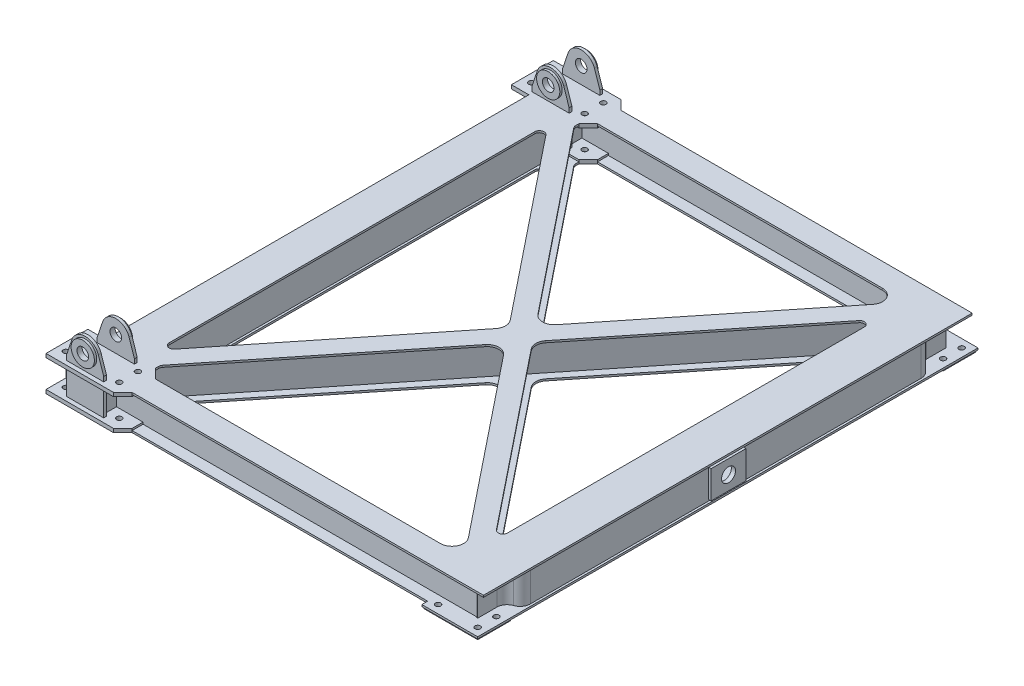
from build123d import *

# Parameters (mm, degrees)
SKETCH_1_W                         = 1765
SKETCH_1_H                         = 2150
EXTRUDE_1_DEPTH                    = 8
SKETCH_2_W                         = 1525
SKETCH_2_H                         = 25
CUT_EXTRUDE_1_DEPTH                = 2782.688156498
SKETCH_4_W                         = 255
SKETCH_4_H                         = 140
CUT_EXTRUDE_2_DEPTH                = 2782.688156498
SKETCH_6_W                         = 6
SKETCH_6_H                         = 1994
SKETCH_6_H_2                       = 2012
EXTRUDE_3_DEPTH                    = 134
SKETCH_7_W                         = 1624
SKETCH_7_H                         = 6
EXTRUDE_5_DEPTH                    = 134
SKETCH_10_W                        = 1765
SKETCH_10_H                        = 2100
EXTRUDE_6_DEPTH                    = 8
CUT_EXTRUDE_3_DEPTH                = 8
FILLET_3_R                         = 50
FILLET_4_R                         = 20
SKETCH_13_R                        = 11.5
EXTRUDE_8_DEPTH                    = 16
EXTRUDE_8_2_DEPTH                  = 16
PATTERN_LINEAR_1_COUNT             = 2
PATTERN_LINEAR_1_PITCH             = 134
SKETCH_14_W                        = 160
SKETCH_14_H                        = 12
EXTRUDE_9_DEPTH                    = 150
SKETCH_15_R                        = 25
CUT_EXTRUDE_4_DEPTH                = 2808.039187471
SKETCH_16_W                        = 160
SKETCH_16_H                        = 12
EXTRUDE_10_DEPTH                   = 134
SKETCH_17_W                        = 6
SKETCH_17_H                        = 118
EXTRUDE_11_DEPTH                   = 84
EXTRUDE_11_2_DEPTH                 = 84
SKETCH_18_W                        = 6
SKETCH_18_H                        = 118
EXTRUDE_12_DEPTH                   = 2132
EXTRUDE_START                      = 10
SKETCH_19_R                        = 50
SKETCH_19_R_2                      = 25
EXTRUDE_13_DEPTH                   = 10
PATTERN_LINEAR_2_COUNT             = 2
PATTERN_LINEAR_2_PITCH             = 154
PATTERN_LINEAR_3_COUNT             = 2
PATTERN_LINEAR_3_PITCH             = 2000
PATTERN_START                      = 10
PATTERN_LINEAR_3_COPY_1_SKETCH_R   = 50
PATTERN_LINEAR_3_COPY_1_SKETCH_R_2 = 25
PATTERN_LINEAR_3_COPY_1_DEPTH      = 10
SKETCH_20_W                        = 230
SKETCH_20_H                        = 140
EXTRUDE_14_DEPTH                   = 8
SKETCH_21_R                        = 11.5
CUT_EXTRUDE_5_DEPTH                = 16
PATTERN_LINEAR_4_COUNT             = 2
PATTERN_LINEAR_4_PITCH             = 170
PATTERN_LINEAR_4_COUNT_DIR2        = 2
PATTERN_LINEAR_4_PITCH_DIR2        = 80
PATTERN_LINEAR_5_COUNT             = 2
PATTERN_LINEAR_5_PITCH             = 2000
PATTERN_LINEAR_5_COPY_1_SKETCH_R   = 11.5
PATTERN_LINEAR_5_COPY_1_DEPTH      = 16
PATTERN_LINEAR_5_COPY_2_SKETCH_R   = 11.5
PATTERN_LINEAR_5_COPY_2_DEPTH      = 16
PATTERN_LINEAR_5_COPY_3_SKETCH_R   = 11.5
PATTERN_LINEAR_5_COPY_3_DEPTH      = 16
SKETCH_23_W                        = 150
SKETCH_23_H                        = 120
EXTRUDE_15_DEPTH                   = 12
SKETCH_24_R                        = 30
CUT_EXTRUDE_6_DEPTH                = 18


with BuildPart() as part:
    # 草图1 → 凸台-拉伸1 (new body)
    with BuildSketch(Plane(origin=(0, 0, 0), x_dir=(1, 0, 0), z_dir=(0, 1, 0))):
        with Locations((882.5, 1075)):
            Rectangle(SKETCH_1_W, SKETCH_1_H)
    extrude(amount=EXTRUDE_1_DEPTH)

    # 草图2 → 切除-拉伸1 (cut, through all)
    with BuildSketch(Plane(origin=(0, 8, 0), x_dir=(1, 0, 0), z_dir=(0, 1, 0))):
        Polygon((215, 2025), (1583.775006101, 2025), (875, 1139.031242374), (215, 1964.031242374), align=None)
        Polygon((1585, 251.531242374), (926.224993899, 1075), (1585, 1898.468757626), align=None)
        Polygon((150, 1917.218757626), (823.775006101, 1075), (150, 232.781242374), align=None)
        Polygon((875, 1010.968757626), (1583.775006101, 125), (215, 125), (215, 185.968757626), align=None)
        with Locations((762.5, 2137.5)):
            Rectangle(SKETCH_2_W, SKETCH_2_H)
        with Locations((762.5, 12.5)):
            Rectangle(SKETCH_2_W, SKETCH_2_H)
    extrude(amount=-CUT_EXTRUDE_1_DEPTH, mode=Mode.SUBTRACT)

    # 草图4 → 切除-拉伸2 (cut, through all)
    with BuildSketch(Plane(origin=(0, 8, 0), x_dir=(1, 0, 0), z_dir=(0, 1, 0))):
        with Locations((127.5, 95)):
            Rectangle(SKETCH_4_W, SKETCH_4_H)
        with Locations((127.5, 2055)):
            Rectangle(SKETCH_4_W, SKETCH_4_H)
    extrude(amount=-CUT_EXTRUDE_2_DEPTH, mode=Mode.SUBTRACT)

    # 草图6 → 凸台-拉伸3 (add)
    with BuildSketch(Plane(origin=(0, 8, 0), x_dir=(1, 0, 0), z_dir=(0, 1, 0))):
        with Locations((138, 1075)):
            Rectangle(SKETCH_6_W, SKETCH_6_H)
        with Locations((12, 1075)):
            Rectangle(SKETCH_6_W, SKETCH_6_H_2)
        with BuildLine():
            Line((1750, 1915), (1750, 235))
            ThreePointArc((1750, 235), (1741.721142199, 209.309534843), (1720, 193.286692771))
            ThreePointArc((1720, 193.286692771), (1698.278857801, 177.263850699), (1690, 151.573385542))
            Line((1690, 151.573385542), (1690, 69))
            Line((1690, 69), (1696, 69))
            Line((1696, 69), (1696, 151.573385542))
            ThreePointArc((1696, 151.573385542), (1704.278857801, 177.263850699), (1726, 193.286692771))
            ThreePointArc((1726, 193.286692771), (1747.721142199, 209.309534843), (1756, 235))
            Line((1756, 235), (1756, 1915))
            ThreePointArc((1756, 1915), (1747.721142199, 1940.690465157), (1726, 1956.713307229))
            ThreePointArc((1726, 1956.713307229), (1704.278857801, 1972.736149301), (1696, 1998.426614458))
            Line((1696, 1998.426614458), (1696, 2081))
            Line((1696, 2081), (1690, 2081))
            Line((1690, 2081), (1690, 1998.426614458))
            ThreePointArc((1690, 1998.426614458), (1698.278857801, 1972.736149301), (1720, 1956.713307229))
            ThreePointArc((1720, 1956.713307229), (1741.721142199, 1940.690465157), (1750, 1915))
        make_face()
        with Locations((1597, 1075)):
            Rectangle(SKETCH_6_W, SKETCH_6_H)
    extrude(amount=EXTRUDE_3_DEPTH)

    # 草图7 → 凸台-拉伸5 (add)
    with BuildSketch(Plane(origin=(0, 8, 0), x_dir=(1, 0, 0), z_dir=(0, 1, 0))):
        with Locations((882.5, 2075)):
            Rectangle(SKETCH_7_W, SKETCH_7_H)
        with Locations((882.5, 75)):
            Rectangle(SKETCH_7_W, SKETCH_7_H)
        Polygon((1594, 1969.177343178), (1594, 1959.572656822), (886.341874542, 1075), (1594, 190.427343178), (1594, 180.822656822), (882.5, 1070.197656822), (141, 143.322656822), (141, 152.927343178), (878.658125458, 1075), (141, 1997.072656822), (141, 2006.677343178), (882.5, 1079.802343178), align=None)
    extrude(amount=EXTRUDE_5_DEPTH)

    # 草图10 → 凸台-拉伸6 (add)
    with BuildSketch(Plane(origin=(0, 142, 0), x_dir=(1, 0, 0), z_dir=(0, 1, 0))):
        with Locations((882.5, 1075)):
            Rectangle(SKETCH_10_W, SKETCH_10_H)
    extrude(amount=EXTRUDE_6_DEPTH)

    # 草图11 → 切除-拉伸3 (cut)
    with BuildSketch(Plane(origin=(0, 150, 0), x_dir=(1, 0, 0), z_dir=(0, 1, 0))):
        Polygon((0, 2125), (255, 2125), (255, 2025), (1583.775006101, 2025), (875, 1139.031242374), (215, 1964.031242374), (215, 1985), (0, 1985), align=None)
        Polygon((823.775006101, 1075), (150, 232.781242374), (150, 1917.218757626), align=None)
        Polygon((1585, 1898.468757626), (926.224993899, 1075), (1585, 251.531242374), align=None)
        Polygon((0, 25), (0, 165), (215, 165), (215, 185.968757626), (875, 1010.968757626), (1583.775006101, 125), (255, 125), (255, 25), align=None)
    extrude(amount=-CUT_EXTRUDE_3_DEPTH, mode=Mode.SUBTRACT)

    # 圆角3
    fillet_3_edges = [part.edges().sort_by_distance(p)[0] for p in [
        (926.224993899, 4, -1075),
        (926.224993899, 146, -1075),
        (875, 4, -1139.031242374),
        (875, 146, -1139.031242374),
        (823.775006101, 4, -1075),
        (823.775006101, 146, -1075),
        (875, 146, -1010.968757626),
        (875, 4, -1010.968757626),
        (1583.775006101, 146, -2025),
        (1583.775006101, 4, -2025),
        (1583.775006101, 146, -125),
        (1583.775006101, 4, -125),
    ]]
    fillet(fillet_3_edges, radius=FILLET_3_R)

    # 圆角4
    fillet_4_edges = [part.edges().sort_by_distance(p)[0] for p in [
        (150, 146, -1917.218757626),
        (150, 4, -1917.218757626),
        (1585, 146, -1898.468757626),
        (1585, 4, -1898.468757626),
        (1585, 146, -251.531242374),
        (1585, 4, -251.531242374),
        (150, 4, -232.781242374),
        (150, 146, -232.781242374),
        (215, 146, -1964.031242374),
        (215, 4, -1964.031242374),
        (215, 4, -185.968757626),
        (215, 146, -185.968757626),
    ]]
    fillet(fillet_4_edges, radius=FILLET_4_R)


with BuildPart() as body_2:
    # 草图13 → 凸台-拉伸8 (new body)
    with BuildSketch(Plane.XZ):
        Polygon((255, -125), (255, -25), (215, 15), (-75, 15), (-75, -165), (215, -165), align=None)
        with Locations((190, -35)):
            Circle(SKETCH_13_R, mode=Mode.SUBTRACT)
        with Locations((190, -115)):
            Circle(SKETCH_13_R, mode=Mode.SUBTRACT)
        with Locations((-40, -35)):
            Circle(SKETCH_13_R, mode=Mode.SUBTRACT)
        with Locations((-40, -115)):
            Circle(SKETCH_13_R, mode=Mode.SUBTRACT)
    extrude_8 = extrude(amount=-EXTRUDE_8_DEPTH)


with BuildPart() as body_3:
    # 草图13 → Extrude 8 2 (new body)
    with BuildSketch(Plane.XZ):
        Polygon((255, -2025), (215, -1985), (-75, -1985), (-75, -2165), (215, -2165), (255, -2125), align=None)
        with Locations((-40, -2035)):
            Circle(SKETCH_13_R, mode=Mode.SUBTRACT)
        with Locations((-40, -2115)):
            Circle(SKETCH_13_R, mode=Mode.SUBTRACT)
        with Locations((190, -2035)):
            Circle(SKETCH_13_R, mode=Mode.SUBTRACT)
        with Locations((190, -2115)):
            Circle(SKETCH_13_R, mode=Mode.SUBTRACT)
    extrude_8_2 = extrude(amount=-EXTRUDE_8_2_DEPTH)


with BuildPart() as part_1:
    add(part.part)

    # 阵列(线性)1: 凸台-拉伸8, Extrude 8 2 ×2
    with Locations(*[(0, i * PATTERN_LINEAR_1_PITCH, 0) for i in range(1, PATTERN_LINEAR_1_COUNT)]):
        add(extrude_8)
        add(extrude_8_2)

    # 草图14 → 凸台-拉伸9 (add)
    with BuildSketch(Plane(origin=(0, 150, 0), x_dir=(1, 0, 0), z_dir=(0, 1, 0))):
        with Locations((75, 2141)):
            Rectangle(SKETCH_14_W, SKETCH_14_H)
        with Locations((75, 2009)):
            Rectangle(SKETCH_14_W, SKETCH_14_H)
        with Locations((75, 141)):
            Rectangle(SKETCH_14_W, SKETCH_14_H)
        with Locations((75, 9)):
            Rectangle(SKETCH_14_W, SKETCH_14_H)
    extrude(amount=EXTRUDE_9_DEPTH)

    # 草图15 → 切除-拉伸4 (cut, through all)
    with BuildSketch(Plane.XY.offset(-3)):
        with Locations((75, 220)):
            Circle(SKETCH_15_R)
        with BuildLine():
            Line((-5, 170), (-5, 300))
            Line((-5, 300), (155, 300))
            Line((155, 300), (155, 170))
            Line((155, 170), (131.899246818, 239.038794908))
            ThreePointArc((131.899246818, 239.038794908), (75, 280), (18.100753182, 239.038794908))
            Line((18.100753182, 239.038794908), (-5, 170))
        make_face()
    extrude(amount=-CUT_EXTRUDE_4_DEPTH, mode=Mode.SUBTRACT)

    add(body_2.part)  # 凸台-拉伸10 merges body 2

    add(body_3.part)  # 凸台-拉伸10 merges body 3
    # 草图16 → 凸台-拉伸10 (add)
    with BuildSketch(Plane(origin=(0, 150, 0), x_dir=(1, 0, 0), z_dir=(0, 1, 0))):
        with Locations((75, 9)):
            Rectangle(SKETCH_16_W, SKETCH_16_H)
        with Locations((75, 141)):
            Rectangle(SKETCH_16_W, SKETCH_16_H)
        with Locations((75, 2009)):
            Rectangle(SKETCH_16_W, SKETCH_16_H)
        with Locations((75, 2141)):
            Rectangle(SKETCH_16_W, SKETCH_16_H)
    extrude(amount=-EXTRUDE_10_DEPTH)



with BuildPart() as body_2_2:
    # 草图17 → 凸台-拉伸11 (new body)
    with BuildSketch(Plane.ZY.offset(75)):
        with Locations((-75, 75)):
            Rectangle(SKETCH_17_W, SKETCH_17_H)
    extrude(amount=-EXTRUDE_11_DEPTH)


with BuildPart() as body_3_2:
    # 草图17 → Extrude 11 2 (new body)
    with BuildSketch(Plane.ZY.offset(75)):
        with Locations((-2075, 75)):
            Rectangle(SKETCH_17_W, SKETCH_17_H)
    extrude(amount=-EXTRUDE_11_2_DEPTH)


with BuildPart() as part_2:
    add(part_1.part)

    add(body_2_2.part)  # 凸台-拉伸12 merges body 2 2

    add(body_3_2.part)  # 凸台-拉伸12 merges body 3 2
    # 草图18 → 凸台-拉伸12 (add)
    with BuildSketch(Plane.XY.offset(-3)):
        with Locations((12, 75)):
            Rectangle(SKETCH_18_W, SKETCH_18_H)
        with Locations((138, 75)):
            Rectangle(SKETCH_18_W, SKETCH_18_H)
    extrude(amount=-EXTRUDE_12_DEPTH)

    # 草图19 → 凸台-拉伸13 (add)
    with BuildSketch(Plane.XY.offset(-3).offset(EXTRUDE_START)):
        with Locations((75, 220)):
            Circle(SKETCH_19_R)
        with Locations((75, 220)):
            Circle(SKETCH_19_R_2, mode=Mode.SUBTRACT)
    extrude_13 = extrude(amount=-EXTRUDE_13_DEPTH)

    # 阵列(线性)2: 凸台-拉伸13 ×2
    with Locations(*[(0, 0, -i * PATTERN_LINEAR_2_PITCH) for i in range(1, PATTERN_LINEAR_2_COUNT)]):
        add(extrude_13)

    # 阵列(线性)3: 凸台-拉伸13 ×2
    with Locations(*[(0, 0, -i * PATTERN_LINEAR_3_PITCH) for i in range(1, PATTERN_LINEAR_3_COUNT)]):
        add(extrude_13)

    # 阵列(线性)3 copy 1 sketch → 阵列(线性)3 copy 1 (add)
    with BuildSketch(Plane.XY.offset(-2157).offset(PATTERN_START)):
        with Locations((75, 220)):
            Circle(PATTERN_LINEAR_3_COPY_1_SKETCH_R)
        with Locations((75, 220)):
            Circle(PATTERN_LINEAR_3_COPY_1_SKETCH_R_2, mode=Mode.SUBTRACT)
    extrude(amount=-PATTERN_LINEAR_3_COPY_1_DEPTH)

    # 草图20 → 凸台-拉伸14 (add)
    with BuildSketch(Plane.XZ):
        with Locations((1645, -75)):
            Rectangle(SKETCH_20_W, SKETCH_20_H)
        with Locations((1645, -2075)):
            Rectangle(SKETCH_20_W, SKETCH_20_H)
    extrude(amount=EXTRUDE_14_DEPTH)

    # 草图21 → 切除-拉伸5 (cut)
    with BuildSketch(Plane.XZ.offset(8)):
        with Locations((1560, -35)):
            Circle(SKETCH_21_R)
    cut_extrude_5 = extrude(amount=-CUT_EXTRUDE_5_DEPTH, mode=Mode.SUBTRACT)

    # 阵列(线性)4: Cut-Extrude 5 2 × 2
    with Locations(*[(i * PATTERN_LINEAR_4_PITCH, 0, -j * PATTERN_LINEAR_4_PITCH_DIR2) for i in range(PATTERN_LINEAR_4_COUNT) for j in range(PATTERN_LINEAR_4_COUNT_DIR2) if (i, j) != (0, 0)]):
        add(cut_extrude_5, mode=Mode.SUBTRACT)

    # 阵列(线性)5: 切除-拉伸5 ×2
    with Locations(*[(0, 0, -i * PATTERN_LINEAR_5_PITCH) for i in range(1, PATTERN_LINEAR_5_COUNT)]):
        add(cut_extrude_5, mode=Mode.SUBTRACT)

    # 阵列(线性)5 copy 1 sketch → 阵列(线性)5 copy 1 (cut)
    with BuildSketch(Plane(origin=(0, -8, -2080), x_dir=(1, 0, 0), z_dir=(0, -1, 0))):
        with Locations((1560, -35)):
            Circle(PATTERN_LINEAR_5_COPY_1_SKETCH_R)
    extrude(amount=-PATTERN_LINEAR_5_COPY_1_DEPTH, mode=Mode.SUBTRACT)

    # 阵列(线性)5 copy 2 sketch → 阵列(线性)5 copy 2 (cut)
    with BuildSketch(Plane(origin=(170, -8, -2000), x_dir=(1, 0, 0), z_dir=(0, -1, 0))):
        with Locations((1560, -35)):
            Circle(PATTERN_LINEAR_5_COPY_2_SKETCH_R)
    extrude(amount=-PATTERN_LINEAR_5_COPY_2_DEPTH, mode=Mode.SUBTRACT)

    # 阵列(线性)5 copy 3 sketch → 阵列(线性)5 copy 3 (cut)
    with BuildSketch(Plane(origin=(170, -8, -2080), x_dir=(1, 0, 0), z_dir=(0, -1, 0))):
        with Locations((1560, -35)):
            Circle(PATTERN_LINEAR_5_COPY_3_SKETCH_R)
    extrude(amount=-PATTERN_LINEAR_5_COPY_3_DEPTH, mode=Mode.SUBTRACT)

    # 草图23 → 凸台-拉伸15 (add)
    with BuildSketch(Plane(origin=(1756, 0, 0), x_dir=(0, 0, -1), z_dir=(1, 0, 0))):
        with Locations((1075, 75)):
            Rectangle(SKETCH_23_W, SKETCH_23_H)
    extrude_15 = extrude(amount=EXTRUDE_15_DEPTH)

    # 草图24 → 切除-拉伸6 (cut)
    with BuildSketch(Plane(origin=(1768, 0, 0), x_dir=(0, 0, -1), z_dir=(1, 0, 0))):
        with Locations((1075, 75)):
            Circle(SKETCH_24_R)
    cut_extrude_6 = extrude(amount=-CUT_EXTRUDE_6_DEPTH, mode=Mode.SUBTRACT)

    # 镜向1: 凸台-拉伸15, 切除-拉伸6 across plane
    add(extrude_15.mirror(Plane(origin=(1675, 0, 0), x_dir=(0, 0, 1), z_dir=(1, 0, 0))))
    add(cut_extrude_6.mirror(Plane(origin=(1675, 0, 0), x_dir=(0, 0, 1), z_dir=(1, 0, 0))), mode=Mode.SUBTRACT)


solid = part_2.part
